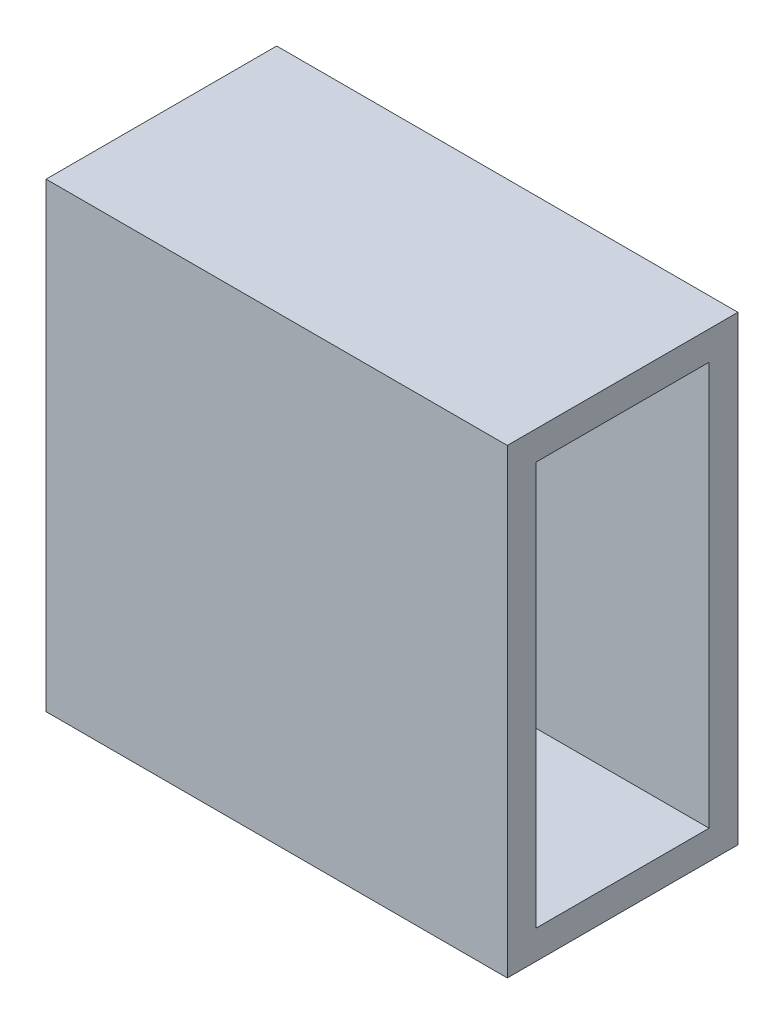
from build123d import *

# Parameters (mm, degrees)
SKETCH1_W           = 25.4
SKETCH1_H           = 50.8
SKETCH1_W_2         = 19.05
SKETCH1_H_2         = 44.45
BOSS_EXTRUDE1_DEPTH = 50.8


with BuildPart() as part:
    # Sketch1 → Boss-Extrude1 (new body)
    with BuildSketch(Plane(origin=(0, 0, 0), x_dir=(0, 0, -1), z_dir=(1, 0, 0))):
        Rectangle(SKETCH1_W, SKETCH1_H)
        Rectangle(SKETCH1_W_2, SKETCH1_H_2, mode=Mode.SUBTRACT)
    extrude(amount=BOSS_EXTRUDE1_DEPTH)


solid = part.part
